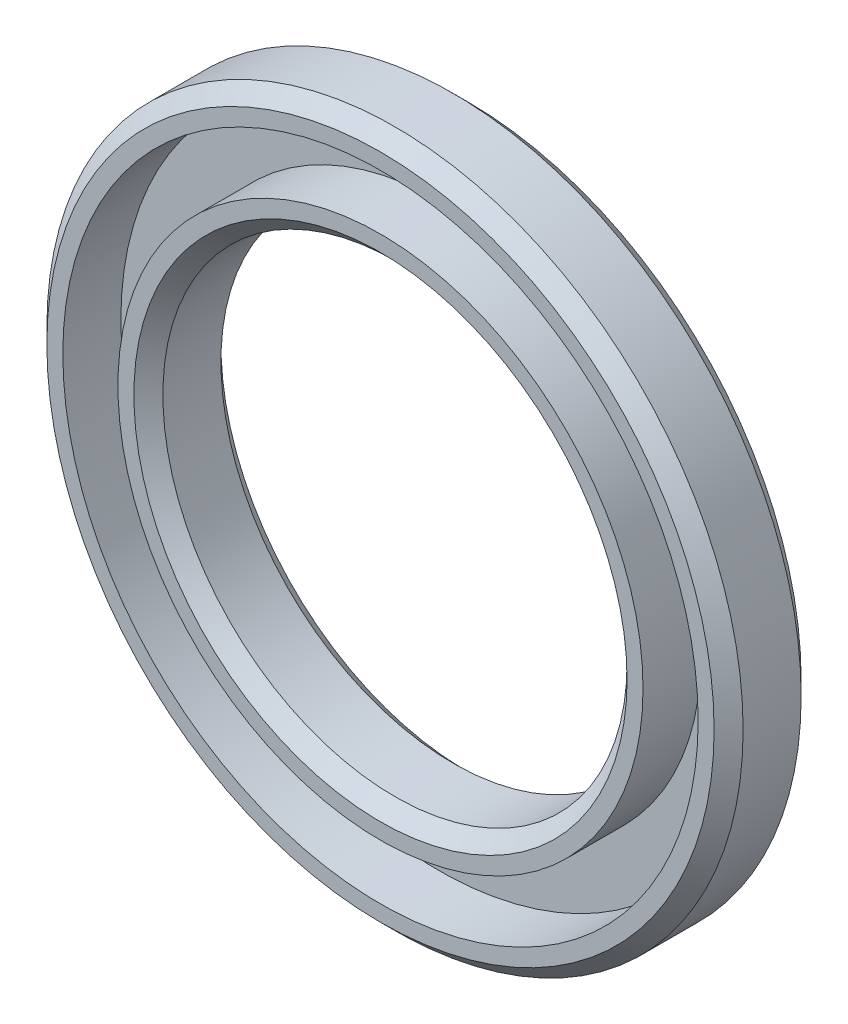
from build123d import *

# Parameters (mm, degrees)
SKETCH1_R           = 12
SKETCH1_R_2         = 8
BOSS_EXTRUDE1_DEPTH = 3
CHAMFER1_SIZE       = 0.5
SKETCH2_R           = 10.95
SKETCH2_R_2         = 9.05
CUT_EXTRUDE1_DEPTH  = 2


with BuildPart() as part:
    # Sketch1 → Boss-Extrude1 (new body)
    with BuildSketch(Plane.XY):
        Circle(SKETCH1_R)
        Circle(SKETCH1_R_2, mode=Mode.SUBTRACT)
    extrude(amount=BOSS_EXTRUDE1_DEPTH)

    # Chamfer1
    chamfer1_edges = [part.edges().sort_by_distance(p)[0] for p in [
        (-12, 0, 0),
        (-8, 0, 0),
        (-8, 0, 3),
        (-12, 0, 3),
    ]]
    chamfer(chamfer1_edges, length=CHAMFER1_SIZE)

    # Sketch2 → Cut-Extrude1 (cut)
    with BuildSketch(Plane.XY.offset(3)):
        Circle(SKETCH2_R)
        Circle(SKETCH2_R_2, mode=Mode.SUBTRACT)
    extrude(amount=-CUT_EXTRUDE1_DEPTH, mode=Mode.SUBTRACT)


solid = part.part
